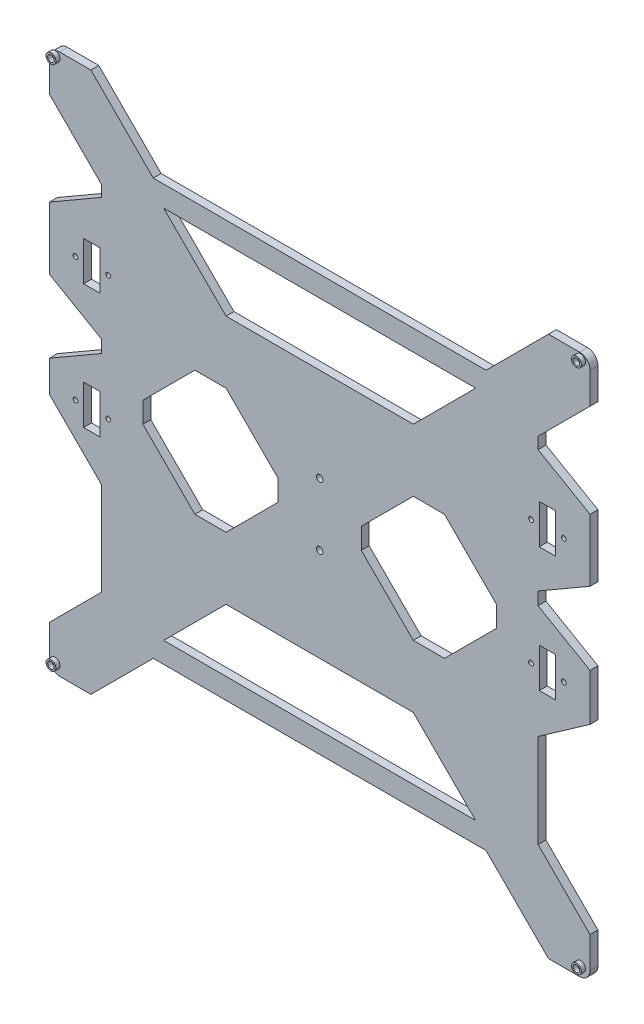
from build123d import *

# Parameters (mm, degrees)
MODEL_R             = 1.4605
MODEL_R_2           = 2
BOSS_EXTRUDE1_DEPTH = 2.413
SKETCH1_W           = 10
SKETCH1_H           = 24
CUT_EXTRUDE1_DEPTH  = 10
SKETCH2_R           = 3
SKETCH2_R_2         = 2
BOSS_EXTRUDE2_DEPTH = 2.54


with BuildPart() as part:
    # Model → Boss-Extrude1 (new, symmetric)
    with BuildSketch(Plane.XY):
        with BuildLine():
            Line((-258.931304326, -12.937428953), (-290.681304326, -31.2683))
            Line((-290.681304326, -31.2683), (-290.681304326, -50.3183))
            Line((-290.681304326, -50.3183), (-258.931304326, -82.0683))
            Line((-258.931304326, -82.0683), (-258.931304326, -139.2183))
            Line((-258.931304326, -139.2183), (-290.681304326, -170.9683))
            Line((-290.681304326, -170.9683), (-290.681304326, -190.0183))
            ThreePointArc((-290.681304326, -190.0183), (-288.821432386, -194.508428061), (-284.331304326, -196.3683))
            Line((-284.331304326, -196.3683), (-265.281304326, -196.3683))
            Line((-265.281304326, -196.3683), (-227.181304326, -158.2683))
            Line((-227.181304326, -158.2683), (-23.981304326, -158.2683))
            Line((-23.981304326, -158.2683), (14.118695674, -196.3683))
            Line((14.118695674, -196.3683), (33.168695674, -196.3683))
            ThreePointArc((33.168695674, -196.3683), (37.658823735, -194.508428061), (39.518695674, -190.0183))
            Line((39.518695674, -190.0183), (39.518695674, -170.9683))
            Line((39.518695674, -170.9683), (7.768695674, -139.2183))
            Line((7.768695674, -139.2183), (7.768695674, -82.0683))
            Line((7.768695674, -82.0683), (10.464640386, -80.18057919))
            Line((10.464640386, -80.18057919), (39.518695674, -59.836710662))
            Line((39.518695674, -59.836710662), (39.518695674, -31.2683))
            Line((39.518695674, -31.2683), (7.768695674, -12.937428953))
            Line((7.768695674, -12.937428953), (7.768695674, -5.149171047))
            Line((7.768695674, -5.149171047), (39.518695674, 13.1817))
            Line((39.518695674, 13.1817), (39.518695674, 51.2817))
            Line((39.518695674, 51.2817), (7.768695674, 69.612571047))
            Line((7.768695674, 69.612571047), (7.768695674, 76.6817))
            Line((7.768695674, 76.6817), (39.518695674, 108.4317))
            Line((39.518695674, 108.4317), (39.518695674, 127.4817))
            ThreePointArc((39.518695674, 127.4817), (37.658823735, 131.971828061), (33.168695674, 133.8317))
            Line((33.168695674, 133.8317), (14.118695674, 133.8317))
            Line((14.118695674, 133.8317), (-23.981304326, 95.7317))
            Line((-23.981304326, 95.7317), (-227.181304326, 95.7317))
            Line((-227.181304326, 95.7317), (-265.281304326, 133.8317))
            Line((-265.281304326, 133.8317), (-284.331304326, 133.8317))
            ThreePointArc((-284.331304326, 133.8317), (-288.821432386, 131.971828061), (-290.681304326, 127.4817))
            Line((-290.681304326, 127.4817), (-290.681304326, 108.4317))
            Line((-290.681304326, 108.4317), (-258.931304326, 76.6817))
            Line((-258.931304326, 76.6817), (-258.931304326, 69.612571047))
            Line((-258.931304326, 69.612571047), (-290.681304326, 51.2817))
            Line((-290.681304326, 51.2817), (-290.681304326, 13.1817))
            Line((-290.681304326, 13.1817), (-258.931304326, -5.149171047))
            Line((-258.931304326, -5.149171047), (-258.931304326, -12.937428953))
        make_face()
        with Locations((-287.125304326, -190.6025)):
            Circle(MODEL_R, mode=Mode.SUBTRACT)
        Polygon((-68.431304326, -107.4683), (-30.331304326, -145.5683), (-220.831304326, -145.5683), (-182.731304326, -107.4683), align=None, mode=Mode.SUBTRACT)
        with Locations((-274.681304256, -45.4288)):
            Circle(MODEL_R, mode=Mode.SUBTRACT)
        with Locations((-254.681304256, -45.4288)):
            Circle(MODEL_R, mode=Mode.SUBTRACT)
        with Locations((-125.581304326, -50.3183)):
            Circle(MODEL_R_2, mode=Mode.SUBTRACT)
        with Locations((33.752895674, -190.6025)):
            Circle(MODEL_R, mode=Mode.SUBTRACT)
        with Locations((3.518695604, -45.4288)):
            Circle(MODEL_R, mode=Mode.SUBTRACT)
        with Locations((23.518695604, -45.4288)):
            Circle(MODEL_R, mode=Mode.SUBTRACT)
        with Locations((-274.681304256, 30.5682)):
            Circle(MODEL_R, mode=Mode.SUBTRACT)
        with Locations((-254.681304256, 30.5682)):
            Circle(MODEL_R, mode=Mode.SUBTRACT)
        Polygon((-182.731304326, -69.3683), (-201.781304326, -69.3683), (-233.531304326, -37.6183), (-233.531304326, -24.9183), (-201.781304326, 6.8317), (-182.731304326, 6.8317), (-150.981304326, -24.9183), (-150.981304326, -37.6183), align=None, mode=Mode.SUBTRACT)
        with Locations((-125.581304326, -12.2183)):
            Circle(MODEL_R_2, mode=Mode.SUBTRACT)
        with Locations((-287.125304326, 130.2757)):
            Circle(MODEL_R, mode=Mode.SUBTRACT)
        Polygon((-182.731304326, 44.9317), (-220.831304326, 83.0317), (-30.331304326, 83.0317), (-68.431304326, 44.9317), align=None, mode=Mode.SUBTRACT)
        Polygon((-68.431304326, -69.3683), (-100.181304326, -37.6183), (-100.181304326, -24.9183), (-68.431304326, 6.8317), (-49.381304326, 6.8317), (-17.631304326, -24.9183), (-17.631304326, -37.6183), (-49.381304326, -69.3683), align=None, mode=Mode.SUBTRACT)
        with Locations((3.518695604, 30.5682)):
            Circle(MODEL_R, mode=Mode.SUBTRACT)
        with Locations((23.518695604, 30.5682)):
            Circle(MODEL_R, mode=Mode.SUBTRACT)
        with Locations((33.752895674, 130.2757)):
            Circle(MODEL_R, mode=Mode.SUBTRACT)
    extrude(amount=BOSS_EXTRUDE1_DEPTH, both=True)

    # Sketch1 → Cut-Extrude1 (cut)
    with BuildSketch(Plane.XY.offset(2.413)):
        with Locations((-264.681304256, -45.4288)):
            Rectangle(SKETCH1_W, SKETCH1_H)
        with Locations((-264.681304256, 30.5712)):
            Rectangle(SKETCH1_W, SKETCH1_H)
        with Locations((13.518695604, 30.5712)):
            Rectangle(SKETCH1_W, SKETCH1_H)
        with Locations((13.518695604, -45.4288)):
            Rectangle(SKETCH1_W, SKETCH1_H)
    extrude(amount=-CUT_EXTRUDE1_DEPTH, mode=Mode.SUBTRACT)

    # Sketch2 → Boss-Extrude2 (add)
    # profile 1 of 4: a face of its own
    with BuildSketch(Plane.XY.offset(2.413)):
        with Locations((33.752895674, -190.6025)):
            Circle(SKETCH2_R)
        with Locations((33.752895674, -190.6025)):
            Circle(SKETCH2_R_2, mode=Mode.SUBTRACT)
    # profile 2 of 4: a face of its own
    with BuildSketch(Plane.XY.offset(2.413)):
        with Locations((-287.125304326, -190.6025)):
            Circle(SKETCH2_R)
        with Locations((-287.125304326, -190.6025)):
            Circle(SKETCH2_R_2, mode=Mode.SUBTRACT)
    # profile 3 of 4: a face of its own
    with BuildSketch(Plane.XY.offset(2.413)):
        with Locations((-287.125304326, 130.2757)):
            Circle(SKETCH2_R)
        with Locations((-287.125304326, 130.2757)):
            Circle(SKETCH2_R_2, mode=Mode.SUBTRACT)
    # profile 4 of 4: a face of its own
    with BuildSketch(Plane.XY.offset(2.413)):
        with Locations((33.752895674, 130.2757)):
            Circle(SKETCH2_R)
        with Locations((33.752895674, 130.2757)):
            Circle(SKETCH2_R_2, mode=Mode.SUBTRACT)
    extrude(amount=BOSS_EXTRUDE2_DEPTH)


solid = part.part
